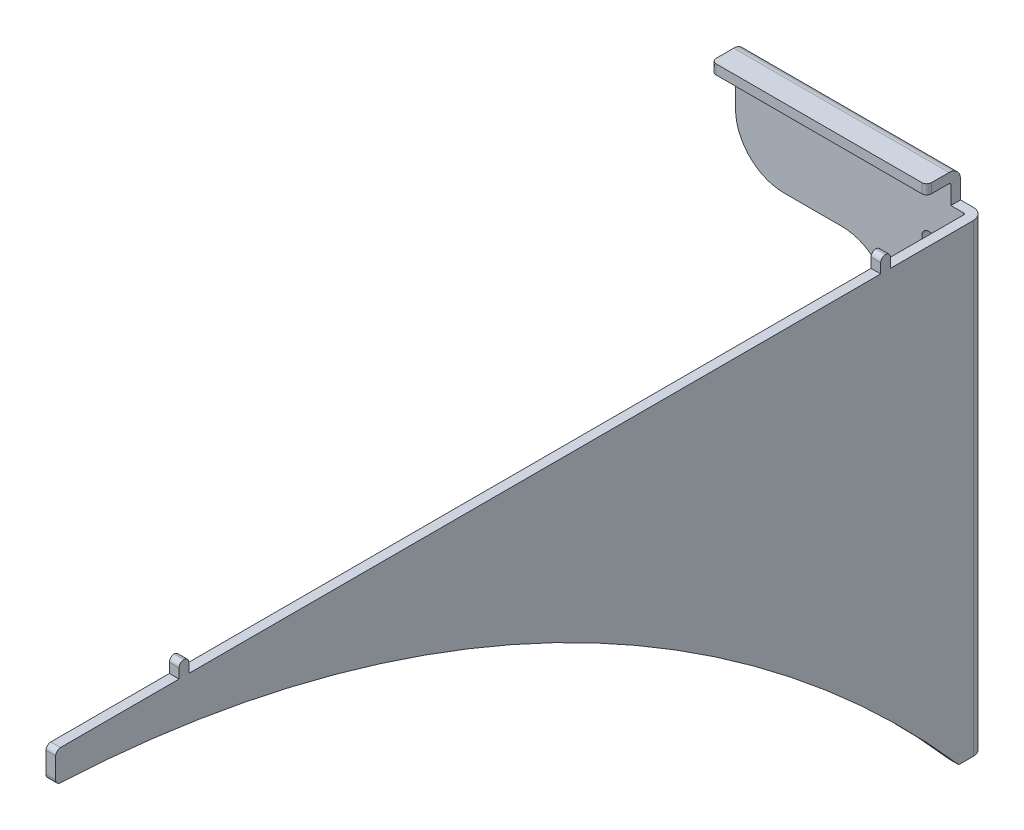
from build123d import *

# Parameters (mm, degrees)
SKETCH1_W                    = 380
SKETCH1_H                    = 200
BASE_FLANGE1_DEPTH           = 4
EDGE_FLANGE1_STRIP_W         = 17.4732
EDGE_FLANGE1_STRIP_H         = 4
EDGE_FLANGE1_STRIP_CUT_DEPTH = 380
EDGE_FLANGE1_DEPTH           = 380
EDGE_FLANGE2_STRIP_W         = 17.4732
EDGE_FLANGE2_STRIP_H         = 4
EDGE_FLANGE2_STRIP_CUT_DEPTH = 199.2634
EDGE_FLANGE2_DEPTH           = 199.2634
EDGE_FLANGE3_STRIP_W         = 17.4732
EDGE_FLANGE3_STRIP_H         = 4
EDGE_FLANGE3_STRIP_CUT_DEPTH = 199.2634
EDGE_FLANGE3_DEPTH           = 199.2634
EXTRUDE1_DEPTH               = 583.765819176
EXTRUDE2_DEPTH               = 583.765819176
FILLET1_R                    = 2
SKETCH15_W                   = 23.472504697
SKETCH15_H                   = 33.276719244
EXTRUDE6_DEPTH               = 10
SKETCH16_W                   = 26.053110818
SKETCH16_H                   = 17.698317339
EXTRUDE7_DEPTH               = 10
FILLET2_R                    = 2
SKETCH17_W                   = 318
SKETCH17_H                   = 161.8
EXTRUDE8_DEPTH               = 578.470345559
FILLET3_R                    = 20
SKETCH18_R                   = 3
EXTRUDE9_DEPTH               = 578.470345559
LPATTERN1_COUNT              = 17
LPATTERN1_PITCH              = 10
SKETCH20_W                   = 800
SKETCH20_H                   = 800
EXTRUDE15_DEPTH              = 581.110334333
FILLET4_R                    = 20
FILLET5_R                    = 2
FILLET6_R                    = 2


# Sheet-metal steps are written as plain solids
with BuildPart() as part:
    # Sketch1 → Base-Flange1 (new body)
    with BuildSketch(Plane.XY):
        with Locations((190, 100)):
            Rectangle(SKETCH1_W, SKETCH1_H)
    extrude(amount=BASE_FLANGE1_DEPTH)

    # Edge-Flange1 strip (across the edge) → Edge-Flange1 strip cut (cut)
    with BuildSketch(Plane(origin=(380, 200, 4), x_dir=(0, -1, 0), z_dir=(-1, 0, 0))):
        with Locations((-8, -2)):
            Rectangle(EDGE_FLANGE1_STRIP_W, EDGE_FLANGE1_STRIP_H)
    extrude(amount=EDGE_FLANGE1_STRIP_CUT_DEPTH, mode=Mode.SUBTRACT)

    # Edge-Flange1 section (across the edge) → Edge-Flange1 (add)
    with BuildSketch(Plane(origin=(380, 200, 4), x_dir=(0, -1, 0), z_dir=(-1, 0, 0))):
        with BuildLine():
            Line((-4, 0.7366), (-4, 10))
            Line((-4, 10), (0, 10))
            Line((0, 10), (0, 0.7366))
            ThreePointArc((0, 0.7366), (0.215745145, 0.215745145), (0.7366, 0))
            Line((0.7366, 0), (0.7366, -4))
            ThreePointArc((0.7366, -4), (-2.61268198, -2.61268198), (-4, 0.7366))
        make_face()
    extrude(amount=EDGE_FLANGE1_DEPTH)

    # Edge-Flange2 strip (across the edge) → Edge-Flange2 strip cut (cut)
    with BuildSketch(Plane(origin=(0, 199.2634, 4), x_dir=(1, 0, 0), z_dir=(0, -1, 0))):
        with Locations((-8, -2)):
            Rectangle(EDGE_FLANGE2_STRIP_W, EDGE_FLANGE2_STRIP_H)
    extrude(amount=EDGE_FLANGE2_STRIP_CUT_DEPTH, mode=Mode.SUBTRACT)

    # Edge-Flange2 section (across the edge) → Edge-Flange2 (add)
    with BuildSketch(Plane(origin=(0, 199.2634, 4), x_dir=(1, 0, 0), z_dir=(0, -1, 0))):
        with BuildLine():
            Line((-4, 0.7366), (-4, 380))
            Line((-4, 380), (0, 380))
            Line((0, 380), (0, 0.7366))
            ThreePointArc((0, 0.7366), (0.215745145, 0.215745145), (0.7366, 0))
            Line((0.7366, 0), (0.7366, -4))
            ThreePointArc((0.7366, -4), (-2.61268198, -2.61268198), (-4, 0.7366))
        make_face()
    extrude(amount=EDGE_FLANGE2_DEPTH)

    # Edge-Flange3 strip (across the edge) → Edge-Flange3 strip cut (cut)
    with BuildSketch(Plane(origin=(380, 0, 4), x_dir=(-1, 0, 0), z_dir=(0, 1, 0))):
        with Locations((-8, -2)):
            Rectangle(EDGE_FLANGE3_STRIP_W, EDGE_FLANGE3_STRIP_H)
    extrude(amount=EDGE_FLANGE3_STRIP_CUT_DEPTH, mode=Mode.SUBTRACT)

    # Edge-Flange3 section (across the edge) → Edge-Flange3 (add)
    with BuildSketch(Plane(origin=(380, 0, 4), x_dir=(-1, 0, 0), z_dir=(0, 1, 0))):
        with BuildLine():
            Line((-4, 0.7366), (-4, 380))
            Line((-4, 380), (0, 380))
            Line((0, 380), (0, 0.7366))
            ThreePointArc((0, 0.7366), (0.215745145, 0.215745145), (0.7366, 0))
            Line((0.7366, 0), (0.7366, -4))
            ThreePointArc((0.7366, -4), (-2.61268198, -2.61268198), (-4, 0.7366))
        make_face()
    extrude(amount=EDGE_FLANGE3_DEPTH)

    # Sketch12 → Extrude1 (cut, through all)
    with BuildSketch(Plane.ZY.offset(4)):
        with BuildLine():
            ThreePointArc((384, 179.2634), (179.031265067, 127.81319162), (10.7366, 0))
            Line((10.7366, 0), (384, 0))
            Line((384, 0), (384, 179.2634))
        make_face()
    extrude(amount=-EXTRUDE1_DEPTH, mode=Mode.SUBTRACT)

    # Sketch13 → Extrude2 (cut, through all)
    with BuildSketch(Plane.ZY.offset(4)):
        Polygon((14.85780282, 191.8), (38.9966, 191.8), (38.9966, 197.8), (42.9966, 197.8), (42.9966, 191.8), (328.9966, 191.8), (328.9966, 197.8), (332.9966, 197.8), (332.9966, 191.8), (384, 191.8), (384, 199.2634), (4.7366, 199.2634), (4.7366, 191.8), align=None)
    extrude(amount=-EXTRUDE2_DEPTH, mode=Mode.SUBTRACT)

    # Fillet1
    fillet1_edges = [part.edges().sort_by_distance(p)[0] for p in [
        (382, 197.8, 38.9966),
        (382, 197.8, 42.9966),
        (382, 197.8, 328.9966),
        (382, 197.8, 332.9966),
        (-2, 197.8, 328.9966),
        (-2, 197.8, 332.9966),
        (-2, 197.8, 42.9966),
        (-2, 197.8, 38.9966),
    ]]
    fillet(fillet1_edges, radius=FILLET1_R - 0.0001)  # a hair under: the kernel refuses the full size

    # Sketch15 → Extrude6 (cut)
    with BuildSketch(Plane.ZY.offset(4)):
        with Locations((8.784947937, 208.438359622)):
            Rectangle(SKETCH15_W, SKETCH15_H)
    extrude(amount=-EXTRUDE6_DEPTH, mode=Mode.SUBTRACT)

    # Sketch16 → Extrude7 (cut)
    with BuildSketch(Plane(origin=(384, 0, 0), x_dir=(0, 0, -1), z_dir=(1, 0, 0))):
        with Locations((-6.110925327, 200.64915867)):
            Rectangle(SKETCH16_W, SKETCH16_H)
    extrude(amount=-EXTRUDE7_DEPTH, mode=Mode.SUBTRACT)

    # Fillet2
    fillet2_edges = [part.edges().sort_by_distance(p)[0] for p in [
        (6, 202, 14),
        (374, 202, 14),
    ]]
    fillet(fillet2_edges, radius=FILLET2_R)

    # Sketch17 → Extrude8 (cut, through all)
    with BuildSketch(Plane.XY.offset(4)):
        with Locations((190, 80.9)):
            Rectangle(SKETCH17_W, SKETCH17_H)
    extrude(amount=-EXTRUDE8_DEPTH, mode=Mode.SUBTRACT)

    # Fillet3
    fillet3_edges = [part.edges().sort_by_distance(p)[0] for p in [
        (31, 161.8, 2),
        (349, 161.8, 2),
    ]]
    fillet(fillet3_edges, radius=FILLET3_R)

    # Sketch18 → Extrude9 (cut, through all)
    with BuildSketch(Plane.XY.offset(4)):
        with Locations((15, 175)):
            Circle(SKETCH18_R)
        with Locations((365, 175)):
            Circle(SKETCH18_R)
    extrude9 = extrude(amount=-EXTRUDE9_DEPTH, mode=Mode.SUBTRACT)

    # LPattern1: Extrude9 ×17
    with Locations(*[(0, -i * LPATTERN1_PITCH, 0) for i in range(1, LPATTERN1_COUNT)]):
        add(extrude9, mode=Mode.SUBTRACT)

    # Sketch20 → Extrude15 (cut, through all)
    with BuildSketch(Plane(origin=(0, 0, 0), x_dir=(-1, 0, 0), z_dir=(0, 0, -1))):
        with Locations((115, -121.057151892)):
            Rectangle(SKETCH20_W, SKETCH20_H)
    extrude(amount=-EXTRUDE15_DEPTH, mode=Mode.SUBTRACT)

    # Fillet4
    fillet4_edges = [part.edges().sort_by_distance(p)[0] for p in [
        (285, 161.8, 2),
    ]]
    fillet(fillet4_edges, radius=FILLET4_R)

    # Fillet5
    fillet5_edges = [part.edges().sort_by_distance(p)[0] for p in [
        (285, 202, 14),
    ]]
    fillet(fillet5_edges, radius=FILLET5_R)

    # Fillet6
    fillet6_edges = [part.edges().sort_by_distance(p)[0] for p in [
        (382, 179.2634, 384),
        (382, 191.8, 384),
    ]]
    fillet(fillet6_edges, radius=FILLET6_R)


solid = part.part
